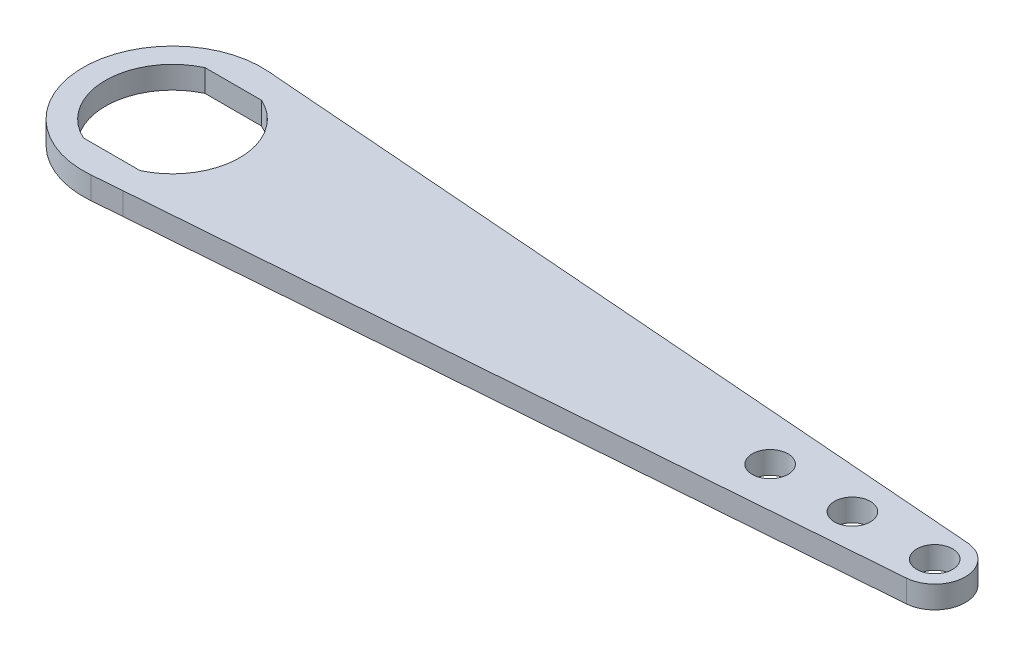
from build123d import *

# Parameters (mm, degrees)
SKETCH1_R               = 2.54
BOSS_EXTRUDE1_DEPTH     = 3.175
CUT_EXTRUDE1_DEPTH      = 114.310823319
CUT_EXTRUDE1_DEPTH_BACK = 114.310823319


with BuildPart() as part:
    # Sketch1 → Boss-Extrude1 (new body)
    with BuildSketch(Plane(origin=(0, 0, 0), x_dir=(1, 0, 0), z_dir=(0, 1, 0))):
        with BuildLine():
            Line((108.539117009, 4.335152614), (5.263477484, 12.318590912))
            ThreePointArc((5.263477484, 12.318590912), (3.157372026, 12.484449553), (1.051753091, 12.656374498))
            ThreePointArc((1.051753091, 12.656374498), (-12.7, 0), (1.051753091, -12.656374498))
            ThreePointArc((1.051753091, -12.656374498), (3.157372026, -12.484449553), (5.263477484, -12.318590912))
            Line((5.263477484, -12.318590912), (108.539117009, -4.335152614))
            ThreePointArc((108.539117009, -4.335152614), (112.55208597, 0), (108.539117009, 4.335152614))
        make_face()
        with Locations((108.204, 0)):
            Circle(SKETCH1_R, mode=Mode.SUBTRACT)
        with Locations((96.52, 0)):
            Circle(SKETCH1_R, mode=Mode.SUBTRACT)
        with Locations((84.836, 0)):
            Circle(SKETCH1_R, mode=Mode.SUBTRACT)
    extrude(amount=BOSS_EXTRUDE1_DEPTH)

    # Sketch3 → Cut-Extrude1 (cut, two sides: drawn at the far end of the back side and taken through both)
    with BuildSketch(Plane(origin=(0, 0, 0), x_dir=(1, 0, 0), z_dir=(0, 1, 0)).offset(-CUT_EXTRUDE1_DEPTH_BACK)):
        with BuildLine():
            Line((-4.018100173, 8.636), (4.018100173, 8.636))
            ThreePointArc((4.018100173, 8.636), (9.525, 0), (4.018100173, -8.636))
            Line((4.018100173, -8.636), (-4.018100173, -8.636))
            ThreePointArc((-4.018100173, -8.636), (-9.525, 0), (-4.018100173, 8.636))
        make_face()
    extrude(amount=CUT_EXTRUDE1_DEPTH + CUT_EXTRUDE1_DEPTH_BACK, mode=Mode.SUBTRACT)


solid = part.part
